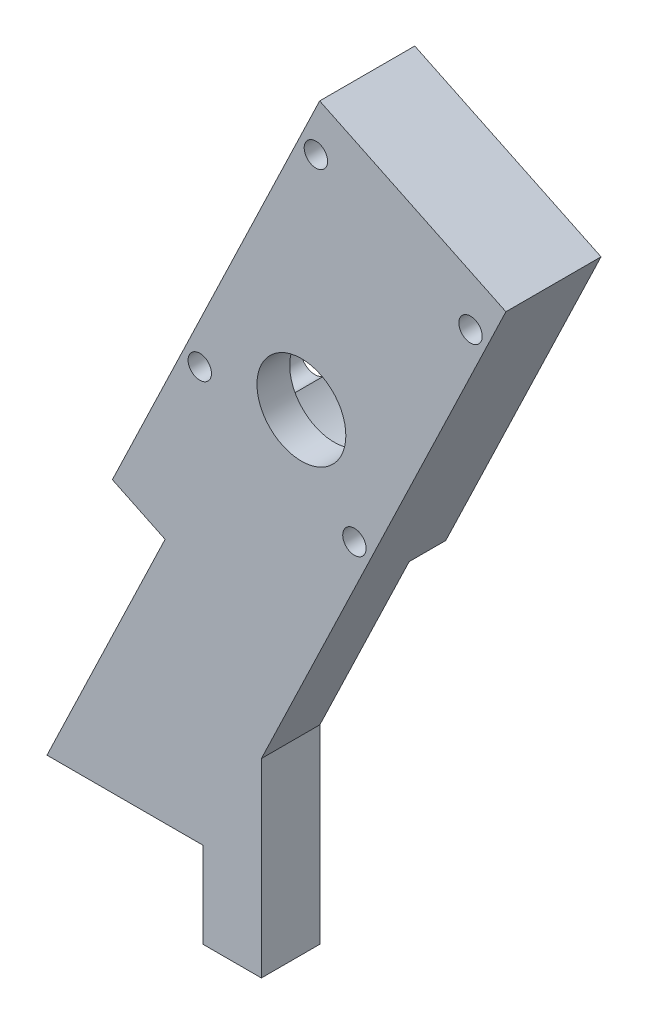
from build123d import *

# Parameters (mm, degrees)
BOSS_EXTRUDE1_DEPTH   = 9.525
BOSS_EXTRUDE2_DEPTH   = 5.969
CAVITY1_START         = -5.969
CAVITY1_OUTLINE_R     = 4.445
CAVITY1_OUTLINE_R_2   = 1.143
CAVITY1_DEPTH         = 10.16
CAVITY1_START_2       = 4.191
CAVITY1_2_OUTLINE_R   = 7.239
CAVITY1_2_OUTLINE_R_2 = 1.143
CAVITY1_2_DEPTH       = 5.334
CAVITY1_3_OUTLINE_R   = 4.445
CAVITY1_3_DEPTH       = 3.048
CAVITY1_4_OUTLINE_R   = 6.35
CAVITY1_4_OUTLINE_R_2 = 4.445
CAVITY1_4_DEPTH       = 1.778
CAVITY1_START_3       = 6.223
CAVITY1_5_OUTLINE_R   = 1.905
CAVITY1_5_OUTLINE_R_2 = 1.143
CAVITY1_5_DEPTH       = 3.302
CAVITY1_6_OUTLINE_R   = 2.286
CAVITY1_6_DEPTH       = 1.27
CAVITY1_START_4       = 7.239
CAVITY1_7_DEPTH       = 0.254


# Read off the part's stored shape, not the designer's step: Cavity1
with BuildPart() as part:
    # Sketch1 → Boss-Extrude1 (new body)
    with BuildSketch(Plane.XY):
        Polygon((-41.443198843, -69.435406513), (-16.043198843, -69.435406513), (-16.043198843, -83.405406513), (-6.518198843, -83.405406513), (-6.518198843, -52.448144489), (33.310925875, 30.495820593), (2.972453908, 45.064147324), (-30.788372585, -25.242615218), (-22.202012594, -29.365726557), align=None)
    extrude(amount=BOSS_EXTRUDE1_DEPTH)

    # Sketch2 → Boss-Extrude2 (add)
    with BuildSketch(Plane(origin=(0, 0, 0), x_dir=(-1, 0, 0), z_dir=(0, 0, -1))):
        Polygon((-2.972453908, 45.064147324), (-33.310925875, 30.495820593), (-8.022509662, -22.167187349), (22.315962304, -7.598860618), align=None)
    extrude(amount=BOSS_EXTRUDE2_DEPTH)

    # Cavity1 outline → Cavity1 (cut)
    with BuildSketch(Plane.XY.offset(CAVITY1_START)):
        with BuildLine():
            ThreePointArc((11.508743469, 8.573215544), (6.212154418, 12.936782386), (-0.504959238, 14.342113414))
            ThreePointArc((-0.504959238, 14.342113414), (-3.150914892, 17.086873862), (-4.643828287, 13.578882864))
            ThreePointArc((-4.643828287, 13.578882864), (-12.936782386, 6.212154417), (-13.500892619, -4.86591199))
            ThreePointArc((-13.500892619, -4.86591199), (-15.305202325, -8.224372608), (-11.508743469, -8.573215544))
            ThreePointArc((-11.508743469, -8.573215544), (-6.212154418, -12.936782386), (0.504959238, -14.342113414))
            ThreePointArc((0.504959238, -14.342113414), (3.150914892, -17.086873862), (4.643828287, -13.578882864))
            ThreePointArc((4.643828287, -13.578882864), (12.936782386, -6.212154417), (13.500892619, 4.86591199))
            ThreePointArc((13.500892619, 4.86591199), (15.305202325, 8.224372608), (11.508743469, 8.573215544))
        make_face()
        with Locations((10.994963571, 22.896959975)):
            Circle(CAVITY1_OUTLINE_R)
        with Locations((2.35982247, 37.187095529)):
            Circle(CAVITY1_OUTLINE_R_2)
        with Locations((27.546478442, 25.092635602)):
            Circle(CAVITY1_OUTLINE_R_2)
        with Locations((8.635141101, -14.290135555)):
            Circle(CAVITY1_OUTLINE_R_2)
        with Locations((-16.551514871, -2.195675627)):
            Circle(CAVITY1_OUTLINE_R_2)
    extrude(amount=CAVITY1_DEPTH, mode=Mode.SUBTRACT)

    # Cavity1 2 outline → Cavity1 2 (cut)
    with BuildSketch(Plane.XY.offset(CAVITY1_START_2)):
        Circle(CAVITY1_2_OUTLINE_R)
        with Locations((2.35982247, 37.187095529)):
            Circle(CAVITY1_2_OUTLINE_R_2)
        with Locations((27.546478442, 25.092635602)):
            Circle(CAVITY1_2_OUTLINE_R_2)
        with Locations((8.635141101, -14.290135555)):
            Circle(CAVITY1_2_OUTLINE_R_2)
        with Locations((-16.551514871, -2.195675627)):
            Circle(CAVITY1_2_OUTLINE_R_2)
    extrude(amount=CAVITY1_2_DEPTH, mode=Mode.SUBTRACT)

    # Cavity1 3 outline → Cavity1 3 (cut)
    with BuildSketch(Plane.XY.offset(CAVITY1_START_2)):
        with BuildLine():
            ThreePointArc((2.747559241, 14.085528716), (3.84823725, 8.013935991), (9.274883676, 10.951152168))
            ThreePointArc((9.274883676, 10.951152168), (6.212154418, 12.936782386), (2.747559241, 14.085528716))
        make_face()
        with Locations((10.994963571, 22.896959975)):
            Circle(CAVITY1_3_OUTLINE_R)
    extrude(amount=CAVITY1_3_DEPTH, mode=Mode.SUBTRACT)

    # Cavity1 4 outline → Cavity1 4 (cut)
    with BuildSketch(Plane.XY.offset(CAVITY1_START)):
        with Locations((11.819585838, 24.614231973)):
            Circle(CAVITY1_4_OUTLINE_R)
        with Locations((10.994963571, 22.896959975)):
            Circle(CAVITY1_4_OUTLINE_R_2, mode=Mode.SUBTRACT)
    extrude(amount=CAVITY1_4_DEPTH, mode=Mode.SUBTRACT)

    # Cavity1 5 outline → Cavity1 5 (cut)
    # profile 1 of 4: a face of its own
    with BuildSketch(Plane.XY.offset(CAVITY1_START_3)):
        with Locations((2.35982247, 37.187095529)):
            Circle(CAVITY1_5_OUTLINE_R)
        with Locations((2.35982247, 37.187095529)):
            Circle(CAVITY1_5_OUTLINE_R_2, mode=Mode.SUBTRACT)
    # profile 2 of 4: a face of its own
    with BuildSketch(Plane.XY.offset(CAVITY1_START_3)):
        with Locations((27.546478442, 25.092635602)):
            Circle(CAVITY1_5_OUTLINE_R)
        with Locations((27.546478442, 25.092635602)):
            Circle(CAVITY1_5_OUTLINE_R_2, mode=Mode.SUBTRACT)
    # profile 3 of 4: a face of its own
    with BuildSketch(Plane.XY.offset(CAVITY1_START_3)):
        with Locations((8.635141101, -14.290135555)):
            Circle(CAVITY1_5_OUTLINE_R)
        with Locations((8.635141101, -14.290135555)):
            Circle(CAVITY1_5_OUTLINE_R_2, mode=Mode.SUBTRACT)
    # profile 4 of 4: a face of its own
    with BuildSketch(Plane.XY.offset(CAVITY1_START_3)):
        with Locations((-16.551514871, -2.195675627)):
            Circle(CAVITY1_5_OUTLINE_R)
        with Locations((-16.551514871, -2.195675627)):
            Circle(CAVITY1_5_OUTLINE_R_2, mode=Mode.SUBTRACT)
    extrude(amount=CAVITY1_5_DEPTH, mode=Mode.SUBTRACT)

    # Cavity1 6 outline → Cavity1 6 (cut)
    with BuildSketch(Plane.XY.offset(CAVITY1_START_2)):
        with Locations((13.291518505, 7.142303538)):
            Circle(CAVITY1_6_OUTLINE_R)
        with Locations((-2.736353477, 14.838778038)):
            Circle(CAVITY1_6_OUTLINE_R)
        with Locations((2.736353477, -14.838778038)):
            Circle(CAVITY1_6_OUTLINE_R)
        with Locations((-13.291518505, -7.142303538)):
            Circle(CAVITY1_6_OUTLINE_R)
    extrude(amount=CAVITY1_6_DEPTH, mode=Mode.SUBTRACT)

    # Cavity1 7 outline → Cavity1 7 (cut)
    with BuildSketch(Plane.XY.offset(CAVITY1_START_4)):
        with BuildLine():
            ThreePointArc((2.747559241, 14.085528716), (3.84823725, 8.013935991), (9.274883676, 10.951152168))
            ThreePointArc((9.274883676, 10.951152168), (6.212154418, 12.936782386), (2.747559241, 14.085528716))
        make_face()
    extrude(amount=CAVITY1_7_DEPTH, mode=Mode.SUBTRACT)


solid = part.part
